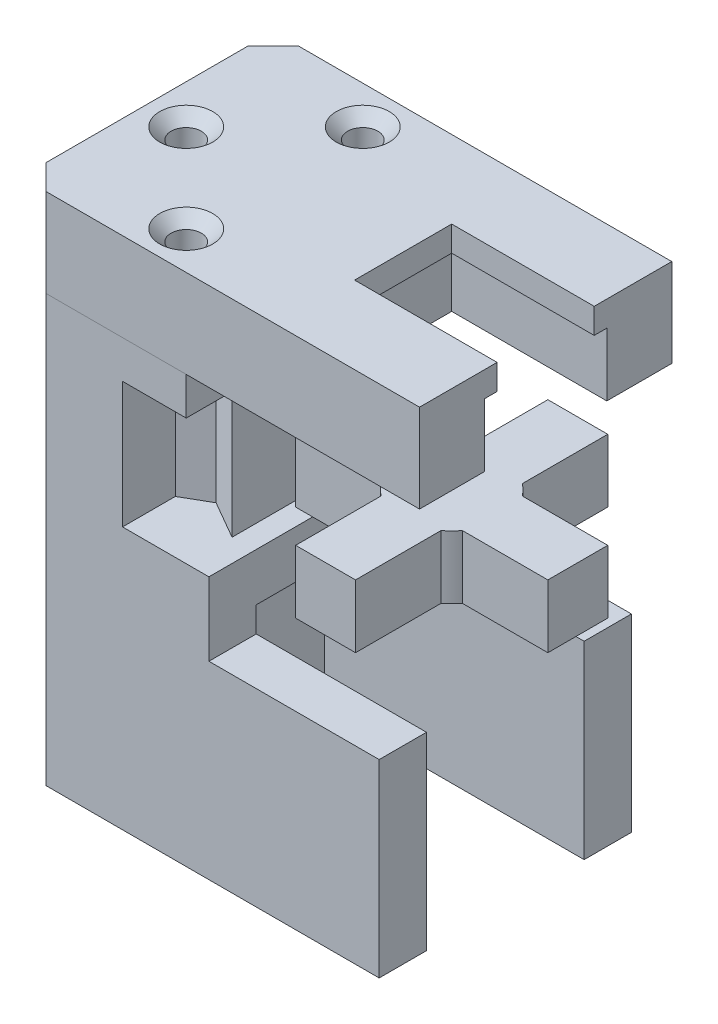
from build123d import *

# Parameters (mm, degrees)
SKETCH1_W                = 22.6
SKETCH1_H                = 15.7
SKETCH1_H_2              = 4.2
BOSS_EXTRUDE1_DEPTH      = 6.25
BOSS_EXTRUDE2_DEPTH      = 4.4
SKETCH4_W                = 9.7
SKETCH4_H                = 9.7
BOSS_EXTRUDE3_DEPTH      = 5
BOSS_EXTRUDE9_DEPTH      = 5
SKETCH8_R                = 3.3
BOSS_EXTRUDE5_DEPTH      = 5.4
BOSS_EXTRUDE5_DRAFT      = 13
BOSS_EXTRUDE6_DEPTH      = 10
SKETCH9_W                = 9.7
SKETCH9_H                = 5
CUT_EXTRUDE1_DEPTH       = 12.3
BOSS_EXTRUDE7_REACH      = 45.909
SKETCH10_W               = 6.15
SKETCH10_H               = 2
BOSS_EXTRUDE8_START      = -19.3
SKETCH11_W               = 7.7
SKETCH11_H               = 2
BOSS_EXTRUDE8_DEPTH      = 20.3
CHAMFER1_SIZE            = 2
SURFACE_EXTRUDE1_1_BACK  = 25
SURFACE_EXTRUDE1_1_DEPTH = 35
SURFACE_EXTRUDE1_2_BACK  = 25
SURFACE_EXTRUDE1_2_DEPTH = 35
CUT_EXTRUDE2_START       = -3
CUT_EXTRUDE2_DEPTH       = 10
CUT_EXTRUDE3_START       = -12.4
SKETCH15_R               = 1.2
CUT_EXTRUDE3_DEPTH       = 10
CHAMFER2_SIZE            = 0.9
SKETCH16_W               = 3.75
SKETCH16_H               = 15
CUT_EXTRUDE4_DEPTH       = 2
MOVE_START               = -6
MOVE_FACE1_DEPTH         = 1.8


# Read off the part's stored shape, not the designer's step: Move Face1
with BuildPart() as part:
    # Sketch1 → Boss-Extrude1 (new, symmetric)
    with BuildSketch(Plane.XY):
        with Locations((0, -7.85)):
            Rectangle(SKETCH1_W, SKETCH1_H)
        Polygon((-16.1, 0), (-11.3, 0), (11.3, 0), (16.1, 0), (16.1, 2.8), (11.3, 2.8), (-11.3, 2.8), (-16.1, 2.8), align=None)
        with Locations((0, 4.9)):
            Rectangle(SKETCH1_W, SKETCH1_H_2)
    extrude(amount=BOSS_EXTRUDE1_DEPTH, both=True)

    # Sketch2 → Boss-Extrude2 (add)
    with BuildSketch(Plane(origin=(0, 7, 0), x_dir=(1, 0, 0), z_dir=(0, 1, 0))):
        with BuildLine():
            ThreePointArc((-0.486469995, -2.9), (11.3, 0), (-0.486469995, 2.9))
            ThreePointArc((-0.486469995, 2.9), (-3.386469995, 0), (-0.486469995, -2.9))
        make_face()
    extrude(amount=BOSS_EXTRUDE2_DEPTH)


with BuildPart() as body_2:
    # Sketch4 → Boss-Extrude3 (new body)
    with BuildSketch(Plane(origin=(0, 28.8, 0), x_dir=(-1, 0, 0), z_dir=(0, -1, 0))):
        with Locations((-5.05, 0)):
            Rectangle(SKETCH4_W, SKETCH4_H)
    extrude(amount=BOSS_EXTRUDE3_DEPTH)


with BuildPart() as body_3:
    # Sketch12 → Boss-Extrude9 (new body)
    with BuildSketch(Plane(origin=(0, 11.4, 0), x_dir=(1, 0, 0), z_dir=(0, 1, 0))):
        with BuildLine():
            Line((-4.95, -2.375), (1.831401703, -2.375))
            ThreePointArc((1.831401703, -2.375), (2.221572875, -2.828427125), (2.675, -3.218598297))
            Line((2.675, -3.218598297), (2.675, -10))
            Line((2.675, -10), (7.425, -10))
            Line((7.425, -10), (7.425, -3.218598297))
            ThreePointArc((7.425, -3.218598297), (7.878427125, -2.828427125), (8.268598297, -2.375))
            Line((8.268598297, -2.375), (15.05, -2.375))
            Line((15.05, -2.375), (15.05, 2.375))
            Line((15.05, 2.375), (8.268598297, 2.375))
            ThreePointArc((8.268598297, 2.375), (7.878427125, 2.828427125), (7.425, 3.218598297))
            Line((7.425, 3.218598297), (7.425, 10))
            Line((7.425, 10), (2.675, 10))
            Line((2.675, 10), (2.675, 3.218598297))
            ThreePointArc((2.675, 3.218598297), (2.221572875, 2.828427125), (1.831401703, 2.375))
            Line((1.831401703, 2.375), (-4.95, 2.375))
            Line((-4.95, 2.375), (-4.95, -2.375))
        make_face()
    extrude(amount=BOSS_EXTRUDE9_DEPTH)


with BuildPart() as boss_extrude5_tool:
    # Sketch8 → Boss-Extrude5 (with draft: the straight prism first)
    with BuildSketch(Plane(origin=(0, 18.4, 0), x_dir=(-1, 0, 0), z_dir=(0, -1, 0))):
        with Locations((-5.05, 0)):
            Circle(SKETCH8_R)
    extrude(amount=-BOSS_EXTRUDE5_DEPTH)
    # Boss-Extrude5: the draft: its side faces are tilted about the plane it starts from
    boss_extrude5_sides = [boss_extrude5_tool.faces().sort_by_distance(p)[0] for p in [
        (8.35, 21.1, 0),
    ]]
    draft(boss_extrude5_sides, Plane(origin=(0, 18.4, 0), x_dir=(-1, 0, 0), z_dir=(0, -1, 0)), BOSS_EXTRUDE5_DRAFT)


with BuildPart() as body_2_1:
    add(body_2.part)

    # Boss-Extrude5: add boss_extrude5_tool
    add(boss_extrude5_tool.part)


with BuildPart() as body_4:
    # Sketch3 → Boss-Extrude6 (new, symmetric)
    with BuildSketch(Plane.XY):
        Polygon((12.5, 28.8), (-19.1, 28.8), (-19.1, -10), (11.3, -10), (11.3, 5), (-6, 5), (-6, 23.8), (12.5, 23.8), align=None)
    extrude(amount=BOSS_EXTRUDE6_DEPTH, both=True)

    # Combine1: cut part, body 2
    add(part.part, mode=Mode.SUBTRACT)
    add(body_2_1.part, mode=Mode.SUBTRACT)

    # Sketch9 → Cut-Extrude1 (cut)
    with BuildSketch(Plane(origin=(0.2, 0, 0), x_dir=(0, 0, -1), z_dir=(1, 0, 0))):
        with Locations((0, 26.3)):
            Rectangle(SKETCH9_W, SKETCH9_H)
    extrude(amount=CUT_EXTRUDE1_DEPTH, mode=Mode.SUBTRACT)

    # Boss-Extrude7: up to this face of the body (flat: up to its plane)
    boss_extrude7_end = Plane(body_4.part.faces().sort_by_distance((-19.1, 9.4, 0))[0])
    # Sketch10 → Boss-Extrude7 (add, up to the picked face)
    with BuildSketch(Plane(origin=(12.5, 0, 0), x_dir=(0, 0, -1), z_dir=(1, 0, 0)), mode=Mode.PRIVATE) as boss_extrude7_sk1:
        with Locations((6.925, 29.8)):
            Rectangle(SKETCH10_W, SKETCH10_H)
    boss_extrude7_tool1 = split(extrude(boss_extrude7_sk1.sketch, amount=-BOSS_EXTRUDE7_REACH, mode=Mode.PRIVATE), bisect_by=boss_extrude7_end, keep=Keep.BOTH, mode=Mode.PRIVATE)
    # Sketch10 → Boss-Extrude7 (add, up to the picked face)
    with BuildSketch(Plane(origin=(12.5, 0, 0), x_dir=(0, 0, -1), z_dir=(1, 0, 0)), mode=Mode.PRIVATE) as boss_extrude7_sk2:
        with Locations((-6.925, 29.8)):
            Rectangle(SKETCH10_W, SKETCH10_H)
    boss_extrude7_tool2 = split(extrude(boss_extrude7_sk2.sketch, amount=-BOSS_EXTRUDE7_REACH, mode=Mode.PRIVATE), bisect_by=boss_extrude7_end, keep=Keep.BOTH, mode=Mode.PRIVATE)
    add(boss_extrude7_tool1.solids().sort_by(Axis((12.5, 29.8, -6.925), (-1, 0, 0)))[0])
    add(boss_extrude7_tool2.solids().sort_by(Axis((12.5, 29.8, 6.925), (-1, 0, 0)))[0])

    # Sketch11 → Boss-Extrude8 (add)
    with BuildSketch(Plane(origin=(0.2, 0, 0), x_dir=(0, 0, -1), z_dir=(1, 0, 0)).offset(BOSS_EXTRUDE8_START)):
        with Locations((0, 29.8)):
            Rectangle(SKETCH11_W, SKETCH11_H)
    extrude(amount=BOSS_EXTRUDE8_DEPTH)

    # Chamfer1
    chamfer1_edges = [body_4.edges().sort_by_distance(p)[0] for p in [
        (-19.1, 10.4, -10),
        (-19.1, 10.4, 10),
    ]]
    chamfer(chamfer1_edges, length=CHAMFER1_SIZE)


with BuildPart() as body_3_2:
    # Split1: the piece behind the surface
    add(body_4.part)
    # Surface-Extrude1: a surface, the sketch's curves swept straight by 35 mm
    with BuildLine(Plane.XY.offset(10).offset(-SURFACE_EXTRUDE1_1_BACK), mode=Mode.PRIVATE) as surface_extrude1_1_path:
        Line((-6, 23.8), (-38.363313576, 23.8))
    surface_extrude1_1 = Shell.extrude(surface_extrude1_1_path.wire(), (0 * SURFACE_EXTRUDE1_1_DEPTH, 0 * SURFACE_EXTRUDE1_1_DEPTH, 1 * SURFACE_EXTRUDE1_1_DEPTH))
    split(bisect_by=surface_extrude1_1, keep=Keep.BOTTOM)


with BuildPart() as body_4_1:
    add(body_4.part)

    # Split1: split by a surface, the side it looks to stays
    # Surface-Extrude1: a surface, the sketch's curves swept straight by 35 mm
    with BuildLine(Plane.XY.offset(10).offset(-SURFACE_EXTRUDE1_2_BACK), mode=Mode.PRIVATE) as surface_extrude1_2_path:
        Line((-6, 23.8), (-38.363313576, 23.8))
    surface_extrude1_2 = Shell.extrude(surface_extrude1_2_path.wire(), (0 * SURFACE_EXTRUDE1_2_DEPTH, 0 * SURFACE_EXTRUDE1_2_DEPTH, 1 * SURFACE_EXTRUDE1_2_DEPTH))
    split(bisect_by=surface_extrude1_2, keep=Keep.TOP)

    # Sketch14 → Cut-Extrude2 (cut)
    with BuildSketch(Plane(origin=(0, 23.8, 0), x_dir=(1, 0, 0), z_dir=(0, 1, 0)).offset(CUT_EXTRUDE2_START)):
        Polygon((-18.05, 1.183568052), (-16, 2.367136104), (-19.1, 2.367136104), (-19.1, -2.367136104), (-16, -2.367136104), (-18.05, -1.183568052), align=None)
        Polygon((-16, -2.367136104), (-13.95, -1.183568052), (-13.95, 1.183568052), (-16, 2.367136104), (-18.05, 1.183568052), (-18.05, -1.183568052), align=None)
        Polygon((-6.95, 8.183568052), (-9, 9.367136104), (-11.05, 8.183568052), (-11.05, 5.816431948), (-9, 4.632863896), (-6.95, 5.816431948), align=None)
        Polygon((-11.05, 10), (-11.05, 8.183568052), (-9, 9.367136104), (-6.95, 8.183568052), (-6.95, 5.816431948), (-6, 6.364914704), (-6, 10), align=None)
        Polygon((-11.05, -8.183568052), (-11.05, -5.816431948), (-9, -4.632863896), (-6.95, -5.816431948), (-6.95, -8.183568052), (-9, -9.367136104), align=None)
        Polygon((-6, -10), (-6, -6.364914704), (-6.95, -5.816431948), (-6.95, -8.183568052), (-9, -9.367136104), (-11.05, -8.183568052), (-11.05, -10), align=None)
    extrude(amount=-CUT_EXTRUDE2_DEPTH, mode=Mode.SUBTRACT)


with BuildPart() as cut_extrude3_tool:
    # Sketch15 → Cut-Extrude3 (new body)
    with BuildSketch(Plane(origin=(0, 18.4, 0), x_dir=(-1, 0, 0), z_dir=(0, -1, 0)).offset(CUT_EXTRUDE3_START)):
        with Locations(Location((9, 7, 0), (0, 0, 90))):
            Circle(SKETCH15_R)
        with Locations(Location((9, -7, 0), (0, 0, 90))):
            Circle(SKETCH15_R)
        with Locations(Location((16, 0, 0), (0, 0, 90))):
            Circle(SKETCH15_R)
    extrude(amount=CUT_EXTRUDE3_DEPTH)


with BuildPart() as body_4_2:
    add(body_4_1.part)

    # Cut-Extrude3: cut by cut_extrude3_tool
    add(cut_extrude3_tool.part, mode=Mode.SUBTRACT)

    # Sketch16 → Cut-Extrude4 (cut)
    with BuildSketch(Plane(origin=(11.3, 0, 0), x_dir=(0, 0, -1), z_dir=(1, 0, 0))):
        with Locations((8.125, -2.5)):
            Rectangle(SKETCH16_W, SKETCH16_H)
        with Locations((-8.125, -2.5)):
            Rectangle(SKETCH16_W, SKETCH16_H)
    extrude(amount=-CUT_EXTRUDE4_DEPTH, mode=Mode.SUBTRACT)

    # Move Face1 outline → Move Face1 (add)
    with BuildSketch(Plane.YZ.offset(MOVE_START)):
        Polygon((7, 6.25), (7, -6.25), (5, -6.25), (5, -10), (10.8, -10), (10.8, 10), (5, 10), (5, 6.25), align=None)
    extrude(amount=MOVE_FACE1_DEPTH)


with BuildPart() as body_3_2_1:
    add(body_3_2.part)

    # Cut-Extrude3: cut by cut_extrude3_tool
    add(cut_extrude3_tool.part, mode=Mode.SUBTRACT)

    # Chamfer2
    chamfer2_edges = [body_3_2_1.edges().sort_by_distance(p)[0] for p in [
        (-9, 30.8, -5.8),
        (-9, 30.8, 8.2),
        (-16, 30.8, 1.2),
    ]]
    chamfer(chamfer2_edges, length=CHAMFER2_SIZE)


solid = Compound([body_3.part, body_4_2.part, body_3_2_1.part])
